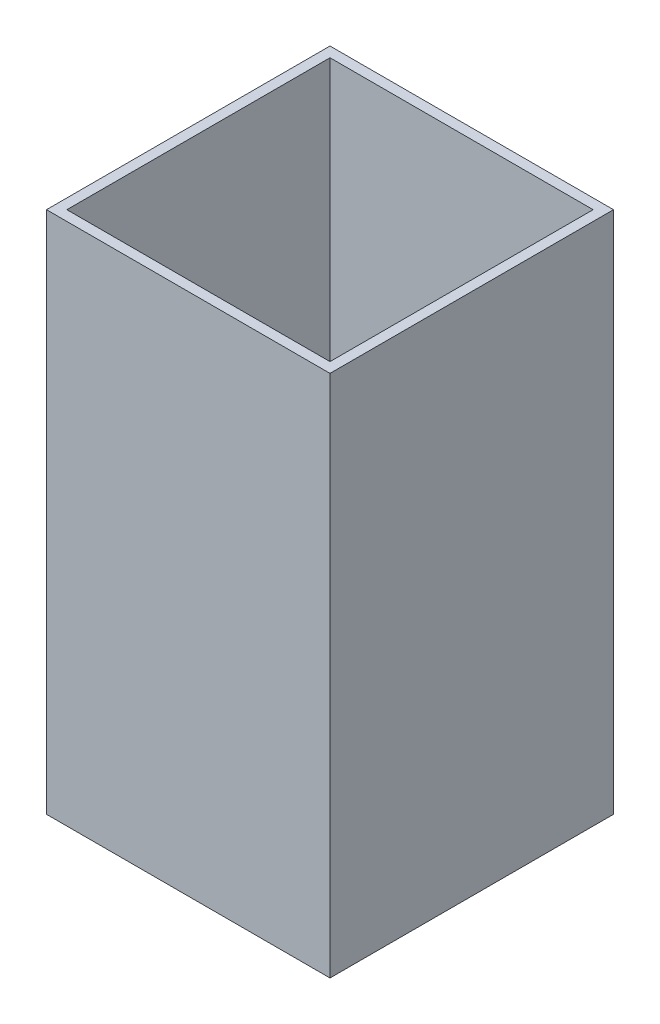
from build123d import *

# Parameters (mm, degrees)
SKETCH1_W           = 88.35
SKETCH1_H           = 88.35
SKETCH1_W_2         = 82
SKETCH1_H_2         = 82
BOSS_EXTRUDE1_DEPTH = 160
SKETCH2_W           = 88.35
SKETCH2_H           = 88.35
BOSS_EXTRUDE2_DEPTH = 3.175


with BuildPart() as part:
    # Sketch1 → Boss-Extrude1 (new body)
    with BuildSketch(Plane(origin=(0, 0, 0), x_dir=(1, 0, 0), z_dir=(0, 1, 0))):
        with Locations((44.175, 44.175)):
            Rectangle(SKETCH1_W, SKETCH1_H)
        with Locations((44.175, 44.175)):
            Rectangle(SKETCH1_W_2, SKETCH1_H_2, mode=Mode.SUBTRACT)
    extrude(amount=BOSS_EXTRUDE1_DEPTH)

    # Sketch2 → Boss-Extrude2 (add)
    with BuildSketch(Plane.XZ):
        with Locations((44.175, -44.175)):
            Rectangle(SKETCH2_W, SKETCH2_H)
    extrude(amount=BOSS_EXTRUDE2_DEPTH)


solid = part.part
